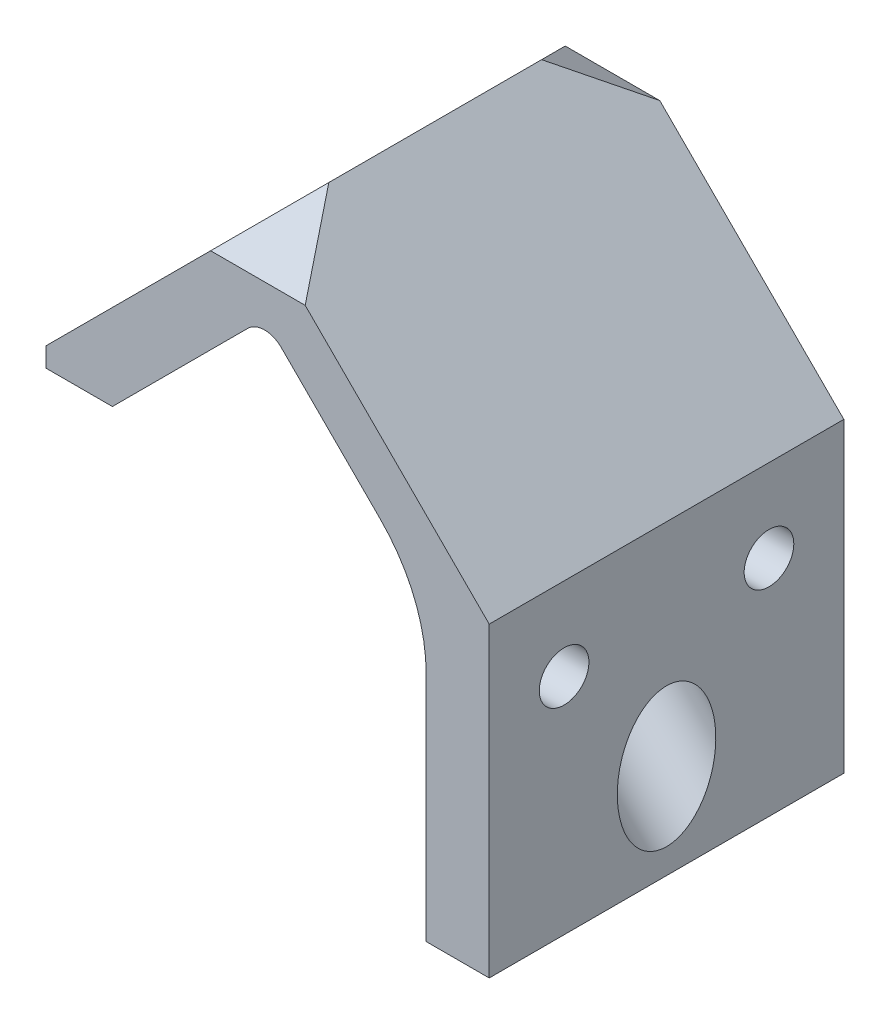
from build123d import *

# Parameters (mm, degrees)
EXTRUDE_505_DEPTH      = 22.5
SKETCH_2_R             = 3.125
SMA_DEPTH              = 42.358123054
SKETCH_3_R             = 1.575
CUT_EXTRUDE_957_DEPTH  = 41.923198727
CUT_EXTRUDE_2_DEPTH    = 1.25
CUT_EXTRUDE_1673_DEPTH = 42.700155069
FILLET_1_R             = 10
FILLET_2_R             = 1.5


with BuildPart() as part:
    # Sketch 1 → Extrude 505 (new body)
    with BuildSketch(Plane.XY):
        Polygon((14.253048327, 0), (14.253048327, -19.446194078), (10.253048327, -19.446194078), (10.253048327, -0.596194078), (0, 9.656854249), (-9.656854249, 0), (-13.859292911, 0), (-13.859292911, 1.242283553), (-0.424264069, 14.677312396), align=None)
    extrude(amount=EXTRUDE_505_DEPTH)

    # Sketch 2 → SMA接口 (cut, through all)
    with BuildSketch(Plane(origin=(-7.550788232, 7.550788232, 0), x_dir=(0, 0, 1), z_dir=(-0.7071067811865486, 0.7071067811865465, 0))):
        with Locations(Location((11.25, 0.578427125, 0), (0, 0, 270))):
            Circle(SKETCH_2_R)
    extrude(amount=-SMA_DEPTH, mode=Mode.SUBTRACT)

    # 草图3 → Cut-Extrude 957 (cut, through all)
    with BuildSketch(Plane(origin=(14.253048327, 0, 0), x_dir=(0, 0, -1), z_dir=(1, 0, 0))):
        with Locations(Location((-17.75, -5.25, 0), (0, 0, 90))):
            Circle(SKETCH_3_R)
        with Locations(Location((-4.75, -5.25, 0), (0, 0, 90))):
            Circle(SKETCH_3_R)
    extrude(amount=-CUT_EXTRUDE_957_DEPTH, mode=Mode.SUBTRACT)

    # 草图4 → 侧板接口-2 (cut)
    with BuildSketch(Plane.ZY.offset(-10.253048327)):
        Polygon((6.33771324, -8), (7.925426481, -5.25), (6.33771324, -2.5), (3.16228676, -2.5), (1.574573519, -5.25), (3.16228676, -8), align=None)
        Polygon((19.33771324, -8), (20.925426481, -5.25), (19.33771324, -2.5), (16.16228676, -2.5), (14.574573519, -5.25), (16.16228676, -8), align=None)
    extrude(amount=-CUT_EXTRUDE_2_DEPTH, mode=Mode.SUBTRACT)

    # 草图7 → Cut-Extrude 1673 (cut, through all)
    with BuildSketch(Plane(origin=(0, 8.084293197, -5.389528798), x_dir=(-1, 0, 0), z_dir=(0, -0.8320502943378436, 0.5547001962252295))):
        Polygon((0.424264069, -11.885734391), (-2.575735931, -6.477407477), (3.424264069, -6.477407477), align=None)
    cut_extrude_1673 = extrude(amount=-CUT_EXTRUDE_1673_DEPTH, mode=Mode.SUBTRACT)

    # 镜向1: Cut-Extrude 1673 across plane
    add(cut_extrude_1673.mirror(Plane.XY.offset(11.25)), mode=Mode.SUBTRACT)

    # 圆角1
    # the kernel refuses this fillet: 10 mm, written as the material it adds along each edge
    with BuildSketch(Plane(origin=(10.253048327, -0.596194078, 0), x_dir=(-0.7071067811865485, 0.7071067811865465, 0), z_dir=(0, 0, 1))) as fillet_1_piece_1_section:
        with BuildLine():
            CenterArc((FILLET_1_R * 0.414213562373, FILLET_1_R), FILLET_1_R, 225, 45)
            Line((-FILLET_1_R * 0.292893218813, FILLET_1_R * 0.292893218813), (0, 0))
            Line((0, 0), (FILLET_1_R * 0.414213562373, 0))
        make_face()
    fillet_1_piece_1 = extrude(amount=22.5, mode=Mode.PRIVATE)
    fillet_1_piece_1 = split(fillet_1_piece_1, bisect_by=Plane(origin=(9.571569557, -2.5, 2.084142207), z_dir=(0, 1, 0)), keep=Keep.TOP, mode=Mode.PRIVATE)
    add(fillet_1_piece_1)
    with BuildSketch(Plane(origin=(10.253048327, -0.596194078, 0), x_dir=(-0.7071067811865485, 0.7071067811865465, 0), z_dir=(0, 0, 1))) as fillet_1_piece_2_section:
        with BuildLine():
            CenterArc((FILLET_1_R * 0.414213562373, FILLET_1_R), FILLET_1_R, 225, 45)
            Line((-FILLET_1_R * 0.292893218813, FILLET_1_R * 0.292893218813), (0, 0))
            Line((0, 0), (FILLET_1_R * 0.414213562373, 0))
        make_face()
    fillet_1_piece_2 = extrude(amount=32.855339059, mode=Mode.PRIVATE)
    fillet_1_piece_2 = split(fillet_1_piece_2, bisect_by=Plane(origin=(10.174215165, -3.639691918, 2.504285324), z_dir=(0, 0.49999999999999994, -0.8660254037844389)), keep=Keep.TOP, mode=Mode.PRIVATE)
    add(fillet_1_piece_2)
    with BuildSketch(Plane(origin=(10.253048327, -0.596194078, -10.355339059), x_dir=(-0.7071067811865485, 0.7071067811865465, 0), z_dir=(0, 0, 1))) as fillet_1_piece_3_section:
        with BuildLine():
            CenterArc((FILLET_1_R * 0.414213562373, FILLET_1_R), FILLET_1_R, 225, 45)
            Line((-FILLET_1_R * 0.292893218813, FILLET_1_R * 0.292893218813), (0, 0))
            Line((0, 0), (FILLET_1_R * 0.414213562373, 0))
        make_face()
    fillet_1_piece_3 = extrude(amount=43.210678119, mode=Mode.PRIVATE)
    fillet_1_piece_3 = split(fillet_1_piece_3, bisect_by=Plane(origin=(10.175314786, -5.028011676, 14.702738538), z_dir=(0, 0.4999999999999995, -0.8660254037844389)), keep=Keep.TOP, mode=Mode.PRIVATE)
    fillet_1_piece_3 = split(fillet_1_piece_3, bisect_by=Plane(origin=(10.175314786, -5.028011676, 7.797261462), z_dir=(0, 0.49999999999999994, 0.8660254037844387)), keep=Keep.TOP, mode=Mode.PRIVATE)
    add(fillet_1_piece_3)
    with BuildSketch(Plane(origin=(10.253048327, -0.596194078, -10.355339059), x_dir=(-0.7071067811865485, 0.7071067811865465, 0), z_dir=(0, 0, 1))) as fillet_1_piece_4_section:
        with BuildLine():
            CenterArc((FILLET_1_R * 0.414213562373, FILLET_1_R), FILLET_1_R, 225, 45)
            Line((-FILLET_1_R * 0.292893218813, FILLET_1_R * 0.292893218813), (0, 0))
            Line((0, 0), (FILLET_1_R * 0.414213562373, 0))
        make_face()
    fillet_1_piece_4 = extrude(amount=32.855339059, mode=Mode.PRIVATE)
    fillet_1_piece_4 = split(fillet_1_piece_4, bisect_by=Plane(origin=(10.174215165, -3.639691918, 19.995714676), z_dir=(0, 0.4999999999999997, 0.8660254037844388)), keep=Keep.TOP, mode=Mode.PRIVATE)
    add(fillet_1_piece_4)

    # 圆角2
    fillet_2_edges = [part.edges().sort_by_distance(p)[0] for p in [
        (0, 9.656854249, 11.25),
    ]]
    fillet(fillet_2_edges, radius=FILLET_2_R)


solid = part.part
